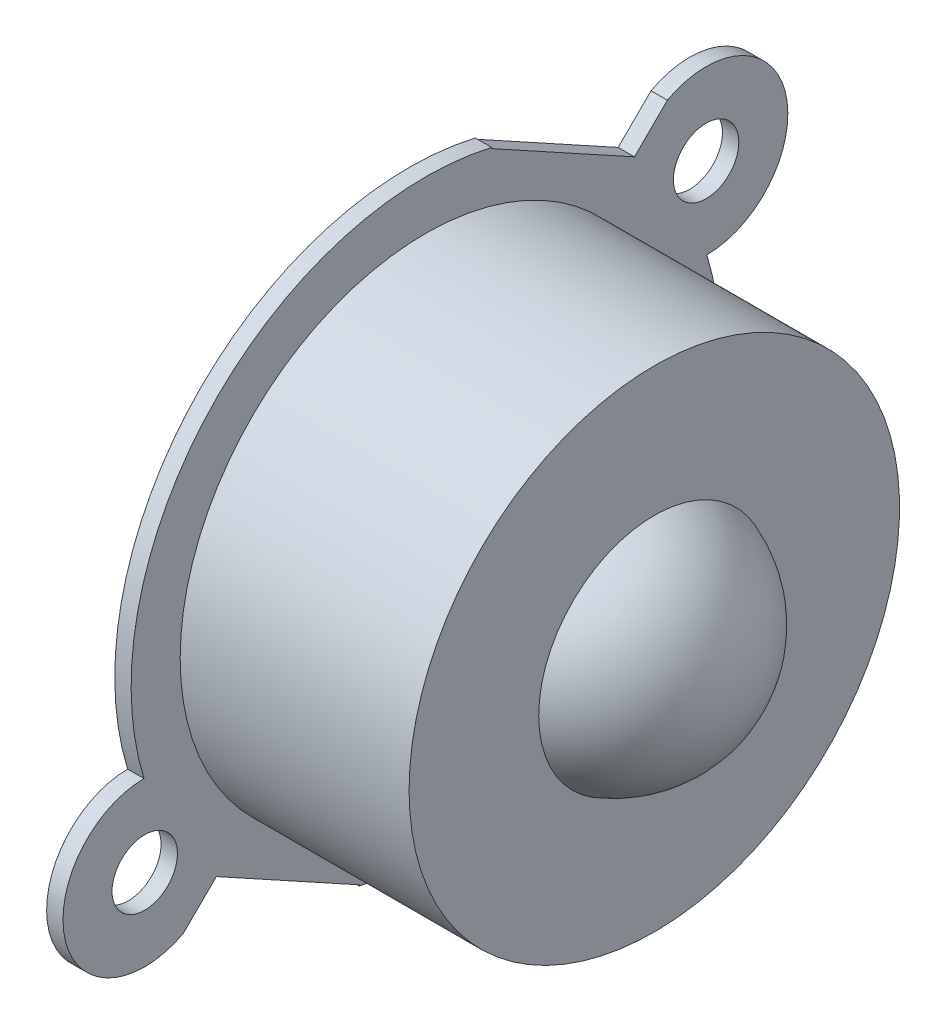
from build123d import *

# Parameters (mm, degrees)
ESQUISSE4_R                     = 2
ENL_V_MAT_EXTRU_1_DEPTH         = 10
R_P_TITION_CIRCULAIRE1_COUNT    = 2
ENL_V_START                     = -1
ENL_V_DE_MAT_EXTRU_MINCE1_DEPTH = 1


# Read off the part's stored shape, not the designer's step: Enlèv. de mat.-Extru.-Mince1
with BuildPart() as part:
    # Esquisse3 → Révolution5 (revolve)
    with BuildSketch(Plane.XY, mode=Mode.PRIVATE) as r_volution5_sk:
        with BuildLine():
            Line((14, -7.071067812), (14, -15))
            Line((14, -15), (0, -15))
            Line((0, -15), (0, -25))
            Line((0, -25), (-1, -25))
            Line((-1, -25), (-1, 0))
            Line((-1, 0), (19, 0))
            ThreePointArc((19, 0), (17.623724357, -4.330127019), (14, -7.071067812))
        make_face()
    revolve(r_volution5_sk.sketch.rotate(Axis((-63.101738984, 0, 0), (1, 0, 0)), 270), axis=Axis((-63.101738984, 0, 0), (1, 0, 0)))

    # Esquisse4 → Enlèv. mat.-Extru.1 (cut)
    with BuildSketch(Plane(origin=(0, 0, 0), x_dir=(0, 0, -1), z_dir=(1, 0, 0))):
        with Locations((17.167855519, 10.259860471)):
            Circle(ESQUISSE4_R)
    enl_v_mat_extru_1 = extrude(amount=-ENL_V_MAT_EXTRU_1_DEPTH, mode=Mode.SUBTRACT)

    # Répétition circulaire1: Enlèv. mat.-Extru.1 ×2 about axis
    r_p_tition_circulaire1_axis = Axis((0, 0, 0), (1, 0, 0))
    for i in range(1, R_P_TITION_CIRCULAIRE1_COUNT):
        add(enl_v_mat_extru_1.rotate(r_p_tition_circulaire1_axis, i * 360 / R_P_TITION_CIRCULAIRE1_COUNT), mode=Mode.SUBTRACT)

    # Enlèv. de mat.-Extru.-Mince1 outline → Enlèv. de mat.-Extru.-Mince1 (cut)
    with BuildSketch(Plane(origin=(0, 0, 0), x_dir=(0, 0, -1), z_dir=(1, 0, 0)).offset(ENL_V_START)):
        with BuildLine():
            ThreePointArc((-21.459819345, -12.824825678), (-21.528104694, -7.812775037), (-17.214284766, -5.260076044))
            ThreePointArc((-17.214284766, -5.260076044), (-13.162462305, 12.278012301), (4.051895913, 17.538019829))
            ThreePointArc((4.051895913, 17.538019829), (4.037882143, 17.51270813), (4.02391722, 17.487369448))
            Line((4.02391722, 17.487369448), (12.786542752, 12.66903013))
            Line((12.786542752, 12.66903013), (14.799239297, 14.663229317))
            ThreePointArc((14.799239297, 14.663229317), (18.49817446, 15.079637594), (21.459819345, 12.824825678))
            ThreePointArc((21.459819345, 12.824825678), (-12.824825678, 21.459819345), (-21.459819345, -12.824825678))
        make_face()
        with BuildLine():
            ThreePointArc((-14.799239297, -14.663229317), (-18.49817446, -15.079637594), (-21.459819345, -12.824825678))
            ThreePointArc((-21.459819345, -12.824825678), (12.824825678, -21.459819345), (21.459819345, 12.824825678))
            ThreePointArc((21.459819345, 12.824825678), (21.528104694, 7.812775037), (17.214284766, 5.260076044))
            ThreePointArc((17.214284766, 5.260076044), (13.162462305, -12.278012301), (-4.051895913, -17.538019829))
            ThreePointArc((-4.051895913, -17.538019829), (-4.037882143, -17.51270813), (-4.02391722, -17.487369448))
            Line((-4.02391722, -17.487369448), (-12.786542752, -12.66903013))
            Line((-12.786542752, -12.66903013), (-14.799239297, -14.663229317))
        make_face()
    extrude(amount=ENL_V_DE_MAT_EXTRU_MINCE1_DEPTH, mode=Mode.SUBTRACT)


solid = part.part
